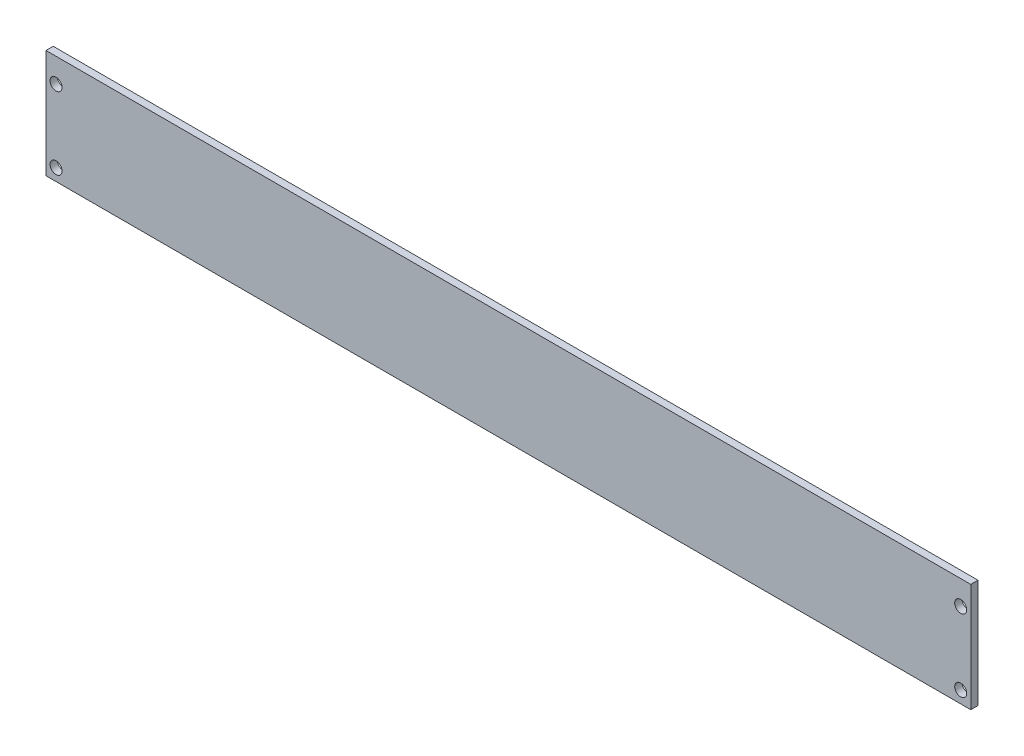
from build123d import *

# Parameters (mm, degrees)
SKETCH1_W           = 292.1
SKETCH1_H           = 34.29
SKETCH1_R           = 1.89865
BOSS_EXTRUDE1_DEPTH = 2.286


with BuildPart() as part:
    # Sketch1 → Boss-Extrude1 (new body)
    with BuildSketch(Plane.XY):
        Rectangle(SKETCH1_W, SKETCH1_H)
        with Locations((-142.875, 9.525)):
            Circle(SKETCH1_R, mode=Mode.SUBTRACT)
        with Locations((-142.875, -13.335)):
            Circle(SKETCH1_R, mode=Mode.SUBTRACT)
        with Locations((142.875, 9.525)):
            Circle(SKETCH1_R, mode=Mode.SUBTRACT)
        with Locations((142.875, -13.335)):
            Circle(SKETCH1_R, mode=Mode.SUBTRACT)
    extrude(amount=BOSS_EXTRUDE1_DEPTH)


solid = part.part
